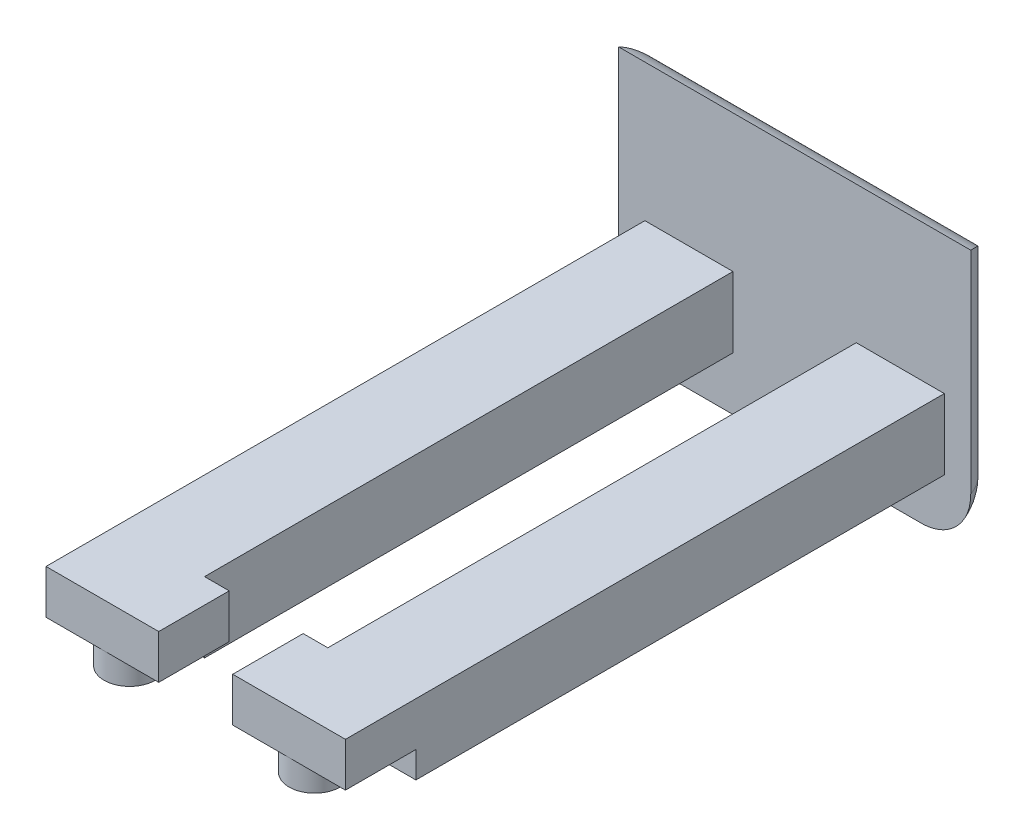
from build123d import *

# Parameters (mm, degrees)
SKETCH1_W             = 50.8
SKETCH1_H             = 38.1
BOSS_EXTRUDE1_DEPTH   = 5.08
SKETCH2_W             = 16.51
SKETCH2_H             = 10.16
BOSS_EXTRUDE2_DEPTH   = 76.2
SKETCH3_W             = 3.81
SKETCH3_H             = 10.16
CUT_EXTRUDE1_DEPTH    = 76.2
SKETCH4_W             = 16.51
SKETCH4_H             = 10.16
BOSS_EXTRUDE3_DEPTH   = 12.7
SKETCH6_W             = 16.51
SKETCH6_H             = 12.7
CUT_EXTRUDE2_DEPTH    = 3.81
SKETCH5_R             = 3.683
BOSS_EXTRUDE4_DEPTH   = 3.81
FILLET1_R             = 7.62
FILLET4_R             = 7.62
FILLET7_R             = 7.62
SKETCH7_W             = 16.51
SKETCH7_H             = 6.35
LEDGE_REDUCTION_DEPTH = 2.54
SKETCH8_W             = 10.16
SKETCH8_H             = 6.35
CUT_EXTRUDE4_DEPTH    = 0.254
SKETCH9_W             = 10.16
SKETCH9_H             = 6.35
CUT_EXTRUDE5_DEPTH    = 0.254


with BuildPart() as part:
    # Sketch1 → Boss-Extrude1 (new body)
    with BuildSketch(Plane.XY):
        Rectangle(SKETCH1_W, SKETCH1_H)
    extrude(amount=BOSS_EXTRUDE1_DEPTH)

    # Sketch2 → Boss-Extrude2 (add)
    with BuildSketch(Plane.XY.offset(5.08)):
        with Locations((-13.335, -5.842)):
            Rectangle(SKETCH2_W, SKETCH2_H)
        with Locations((13.335, -5.842)):
            Rectangle(SKETCH2_W, SKETCH2_H)
    extrude(amount=BOSS_EXTRUDE2_DEPTH)

    # Sketch3 → Cut-Extrude1 (cut)
    with BuildSketch(Plane.XY.offset(81.28)):
        with Locations((-6.985, -5.842)):
            Rectangle(SKETCH3_W, SKETCH3_H)
        with Locations((6.985, -5.842)):
            Rectangle(SKETCH3_W, SKETCH3_H)
    extrude(amount=-CUT_EXTRUDE1_DEPTH, mode=Mode.SUBTRACT)

    # Sketch4 → Boss-Extrude3 (add)
    with BuildSketch(Plane.XY.offset(81.28)):
        with Locations((-13.335, -5.842)):
            Rectangle(SKETCH4_W, SKETCH4_H)
        with Locations((13.335, -5.842)):
            Rectangle(SKETCH4_W, SKETCH4_H)
    extrude(amount=BOSS_EXTRUDE3_DEPTH)

    # Sketch6 → Cut-Extrude2 (cut)
    with BuildSketch(Plane.XZ.offset(10.922)):
        with Locations((-13.335, 87.63)):
            Rectangle(SKETCH6_W, SKETCH6_H)
        with Locations((13.335, 87.63)):
            Rectangle(SKETCH6_W, SKETCH6_H)
    extrude(amount=-CUT_EXTRUDE2_DEPTH, mode=Mode.SUBTRACT)

    # Sketch5 → Boss-Extrude4 (add)
    with BuildSketch(Plane.XZ.offset(10.922)):
        with Locations(Location((-13.335, 87.63, 0), (0, 0, 270))):
            Circle(SKETCH5_R)
        with Locations(Location((13.335, 87.63, 0), (0, 0, 270))):
            Circle(SKETCH5_R)
    extrude(amount=-BOSS_EXTRUDE4_DEPTH)

    # Fillet1
    # the kernel refuses this fillet: 7.62 mm, written as the material it takes off along each edge
    with BuildSketch(Plane(origin=(-43.360512242, 19.05, 0), x_dir=(0, -1, 0), z_dir=(1, 0, 0))) as fillet1_piece_1:
        with BuildLine():
            CenterArc((7.184204897, -7.62), FILLET1_R, 90, 70.528779366)
            Line((0, -5.08), (-0.143684098, -5.0292))
            ThreePointArc((-0.143684098, -5.0292), (-0.1524, -2.54), (-0.1524, 0))
            Line((-0.1524, 0), (0, 0.1524))
            Line((0, 0.1524), (7.184204897, 0.1524))
            Line((7.184204897, 0.1524), (7.184204897, 0))
        make_face()
    extrude(amount=86.721024484, mode=Mode.SUBTRACT)

    # Fillet4
    # the kernel refuses this fillet: 7.62 mm, written as the material it takes off along each edge
    with BuildSketch(Plane(origin=(-25.4, -37.010512242, 0), x_dir=(0, 0, 1), z_dir=(0, 1, 0)), Plane(origin=(25.4, 29.826307345, 0), x_dir=(0, 0, 1), z_dir=(0, -1, 0))) as fillet4_piece_1:
        with BuildLine():
            CenterArc((7.62, 7.184204897), FILLET4_R, 180, 70.528779366)
            Line((0, 7.184204897), (-0.1524, 7.184204897))
            Line((-0.1524, 7.184204897), (-0.1524, 0))
            Line((-0.1524, 0), (0, -0.1524))
            ThreePointArc((0, -0.1524), (2.54, -0.1524), (5.0292, -0.143684098))
            Line((5.0292, -0.143684098), (5.08, 0))
        make_face()
    extrude(amount=66.836819587, mode=Mode.SUBTRACT)

    # Fillet7
    # the kernel refuses this fillet: 7.62 mm, written as the material it takes off along each edge
    with BuildSketch(Plane(origin=(-18.215795103, -19.05, 7.62), x_dir=(0.5563472554155052, 0, 0.8309498970405103), z_dir=(0.8309498970405103, 0, -0.5563472554155052))) as fillet7_piece_1:
        with BuildLine():
            CenterArc((7.62 - FILLET7_R, -FILLET7_R), FILLET7_R, 0, 90)
            Line((7.62, -FILLET7_R), (7.62, 0))
            Line((7.62, 0), (7.62 - FILLET7_R, 0))
        make_face()
    revolve(axis=Axis((-18.215795103, -19.05, 7.62), (0, -1, 0)), revolution_arc=213.803560609, mode=Mode.SUBTRACT)
    with BuildSketch(Plane(origin=(18.215795103, -19.05, 7.62), x_dir=(-0.5563472554155037, 0, 0.8309498970405114), z_dir=(-0.8309498970405114, 0, -0.5563472554155037))) as fillet7_piece_2:
        with BuildLine():
            CenterArc((7.62 - FILLET7_R, FILLET7_R), FILLET7_R, 270, 90)
            Line((7.62, FILLET7_R), (7.62, 0))
            Line((7.62, 0), (7.62 - FILLET7_R, 0))
        make_face()
    revolve(axis=Axis((18.215795103, -19.05, 7.62), (0, 1, 0)), revolution_arc=213.803560609, mode=Mode.SUBTRACT)
    with BuildSketch(Plane(origin=(18.215795103, -19.05, 0), x_dir=(0, 0, 1), z_dir=(-1, 0, 0))) as fillet7_piece_3:
        with BuildLine():
            CenterArc((FILLET7_R, FILLET7_R), FILLET7_R, 180, 90)
            Line((0, FILLET7_R), (0, 0))
            Line((0, 0), (FILLET7_R, 0))
        make_face()
    extrude(amount=36.431590206, mode=Mode.SUBTRACT)

    # Sketch7 → ledge-reduction (cut)
    with BuildSketch(Plane.XY.offset(93.98)):
        with Locations((-13.335, -3.937)):
            Rectangle(SKETCH7_W, SKETCH7_H)
        with Locations((13.335, -3.937)):
            Rectangle(SKETCH7_W, SKETCH7_H)
    extrude(amount=-LEDGE_REDUCTION_DEPTH, mode=Mode.SUBTRACT)

    # Sketch8 → Cut-Extrude4 (cut)
    with BuildSketch(Plane.ZY.offset(-5.08)):
        with Locations((86.36, -3.937)):
            Rectangle(SKETCH8_W, SKETCH8_H)
    extrude(amount=-CUT_EXTRUDE4_DEPTH, mode=Mode.SUBTRACT)

    # Sketch9 → Cut-Extrude5 (cut)
    with BuildSketch(Plane(origin=(-5.08, 0, 0), x_dir=(0, 0, -1), z_dir=(1, 0, 0))):
        with Locations((-86.36, -3.937)):
            Rectangle(SKETCH9_W, SKETCH9_H)
    extrude(amount=-CUT_EXTRUDE5_DEPTH, mode=Mode.SUBTRACT)


solid = part.part
